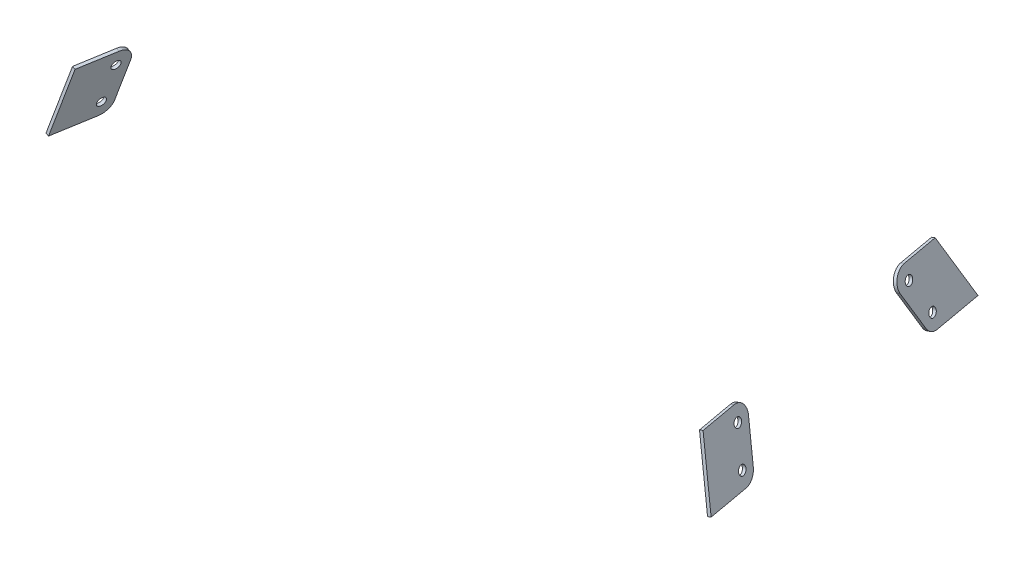
from build123d import *

# Parameters (mm, degrees)
SKETCH1_R             = 2.75
BOSS_EXTRUDE1_DEPTH   = 2
BOSS_EXTRUDE1_2_DEPTH = 2


with BuildPart() as part:
    # Sketch1 → Boss-Extrude1 (new body)
    with BuildSketch(Plane(origin=(623.125546732, 157.915886952, -108.061795504), x_dir=(-0.16069859429951297, -0.04072511740827599, -0.9861629817642938), z_dir=(0.9559431723322133, 0.24226035142727562, -0.1657786880083122))):
        with BuildLine():
            Line((1437.793228038, 806.51446968), (1413.90996939, 805.368296463))
            Line((1413.90996939, 805.368296463), (1408.034710547, 765.040303377))
            Line((1408.034710547, 765.040303377), (1435.035040511, 766.336066887))
            ThreePointArc((1435.035040511, 766.336066887), (1440.028352672, 768.403183648), (1442.567985963, 773.173550593))
            Line((1442.567985963, 773.173550593), (1446.093141269, 797.370346445))
            ThreePointArc((1446.093141269, 797.370346445), (1444.100398637, 803.90046226), (1437.793228038, 806.51446968))
        make_face()
        with Locations((1434.798438093, 775.335070185)):
            Circle(SKETCH1_R, mode=Mode.SUBTRACT)
        with Locations((1438.029830456, 797.515466382)):
            Circle(SKETCH1_R, mode=Mode.SUBTRACT)
    extrude(amount=-BOSS_EXTRUDE1_DEPTH)


with BuildPart() as body_2:
    # Sketch1 → Boss-Extrude1 2 (new body)
    with BuildSketch(Plane(origin=(623.125546732, 157.915886952, -108.061795504), x_dir=(-0.16069859429951297, -0.04072511740827599, -0.9861629817642938), z_dir=(0.9559431723322133, 0.24226035142727562, -0.1657786880083122))):
        with BuildLine():
            Line((1614.084476429, 774.928766528), (1593.091817431, 813.967350648))
            Line((1593.091817431, 813.967350648), (1569.235606938, 812.822475489))
            ThreePointArc((1569.235606938, 812.822475489), (1562.655684664, 808.770069485), (1562.573204783, 801.042808093))
            Line((1562.573204783, 801.042808093), (1575.168800181, 777.619657621))
            ThreePointArc((1575.168800181, 777.619657621), (1578.27628876, 774.445115383), (1582.598170116, 773.417718076))
            Line((1582.598170116, 773.417718076), (1614.084476429, 774.928766528))
        make_face()
        with Locations((1581.689869751, 782.38448615)):
            Circle(SKETCH1_R, mode=Mode.SUBTRACT)
        with Locations((1570.143907303, 803.855707416)):
            Circle(SKETCH1_R, mode=Mode.SUBTRACT)
    extrude(amount=-BOSS_EXTRUDE1_2_DEPTH)


with BuildPart() as body_3:
    # Mirror2: mirrored copy
    add(part.part.mirror(Plane(origin=(0, 0, 0), x_dir=(0, 0, 1), z_dir=(1, 0, 0))))


solid = Compound([part.part, body_2.part, body_3.part])
